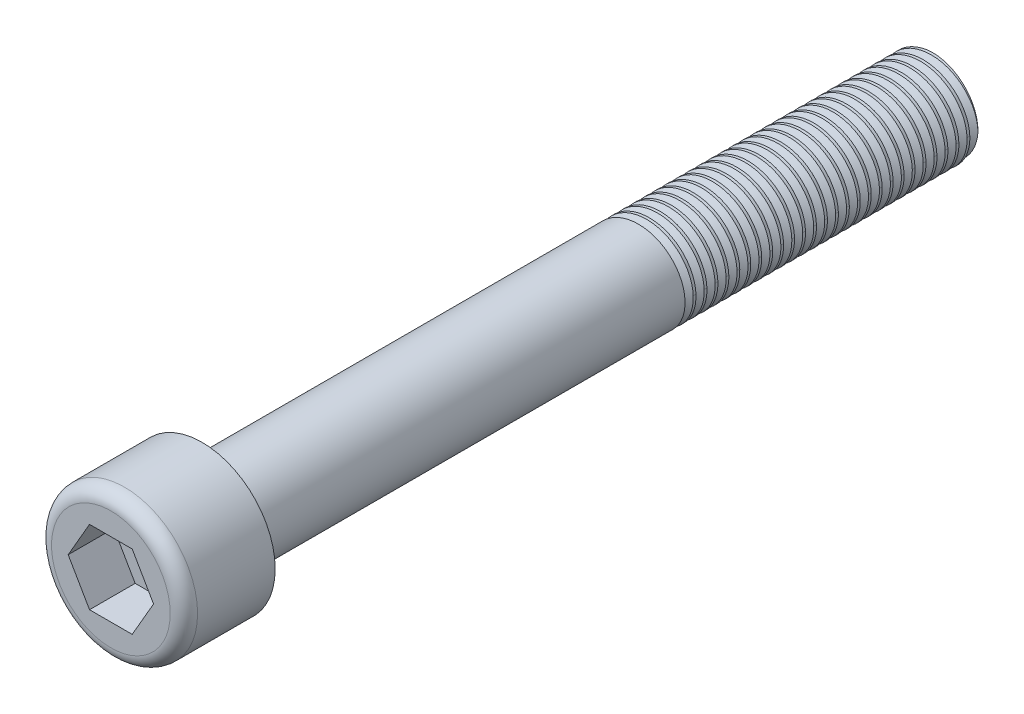
from build123d import *

# Parameters (mm, degrees)
SKETCH1_R           = 8
BOSS_EXTRUDE1_DEPTH = 10
FILLET1_R           = 1.5
CUT_EXTRUDE1_DEPTH  = 5
SKETCH4_R           = 5
BOSS_EXTRUDE2_DEPTH = 80
CUT_SWEEP1_PITCH    = 1.2
CUT_EXTRUDE2_DEPTH  = 80


with BuildPart() as part:
    # Sketch1 → Boss-Extrude1 (new body)
    with BuildSketch(Plane.XY):
        Circle(SKETCH1_R)
    extrude(amount=BOSS_EXTRUDE1_DEPTH)

    # Fillet1
    fillet1_edges = [part.edges().sort_by_distance(p)[0] for p in [
        (-8, 0, 10),
    ]]
    fillet(fillet1_edges, radius=FILLET1_R)

    # Sketch2 → Cut-Extrude1 (cut)
    with BuildSketch(Plane.XY.offset(10)):
        Polygon((4.67653718, 0), (2.33826859, 4.05), (-2.33826859, 4.05), (-4.67653718, 0), (-2.33826859, -4.05), (2.33826859, -4.05), align=None)
    extrude(amount=-CUT_EXTRUDE1_DEPTH, mode=Mode.SUBTRACT)

    # Sketch4 → Boss-Extrude2 (add)
    with BuildSketch(Plane(origin=(0, 0, 0), x_dir=(-1, 0, 0), z_dir=(0, 0, -1))):
        Circle(SKETCH4_R)
    extrude(amount=BOSS_EXTRUDE2_DEPTH)

    # Cut-Sweep1: the profile of Sketch6 profile screwed along a right-hand helix of 27.5 turns, 8 arcs to a turn; built about Z, then put on its axis
    cut_sweep1_z = Axis((0, 0, 0), (0, 0, 1))
    cut_sweep1_corners = [(5.0003, 0, 0.000210062), (5.0003, 0, -0.900210062), (4.357333397, 0, -0.45)]
    with BuildLine(mode=Mode.PRIVATE) as cut_sweep1_profile:
        Line(cut_sweep1_corners[0], cut_sweep1_corners[1])
        Line(cut_sweep1_corners[1], cut_sweep1_corners[2])
        Line(cut_sweep1_corners[2], cut_sweep1_corners[0])
    cut_sweep1_cap = Face(cut_sweep1_profile.wire())
    cut_sweep1_turn_angles = [0, 22.5, 45, 67.5, 90, 112.5, 135, 157.5, 180, 202.5, 225, 247.5, 270, 292.5, 315, 337.5, 360]
    cut_sweep1_turn_weights = [1, 0.9238795325112867, 1, 0.9238795325112867, 1, 0.9238795325112867, 1, 0.9238795325112867, 1, 0.9238795325112867, 1, 0.9238795325112867, 1, 0.9238795325112867, 1, 0.9238795325112867, 1]
    cut_sweep1_turn_rails = [Edge.make_bspline([Vector(p[0], p[1], 0).rotate(cut_sweep1_z, cut_sweep1_turn_angles[k]) / cut_sweep1_turn_weights[k] + Vector(0, 0, p[2] + CUT_SWEEP1_PITCH * cut_sweep1_turn_angles[k] / 360) for k in range(17)], [0, 0, 0, 1, 1, 2, 2, 3, 3, 4, 4, 5, 5, 6, 6, 7, 7, 8, 8, 8], 2, cut_sweep1_turn_weights) for p in cut_sweep1_corners]
    cut_sweep1_turn_sides = [Face.make_surface_from_curves(cut_sweep1_turn_rails[p[0]], cut_sweep1_turn_rails[p[1]]) for p in [(0, 1), (1, 2), (2, 0)]]
    cut_sweep1_last_angles = [9720, 9742.5, 9765, 9787.5, 9810, 9832.5, 9855, 9877.5, 9900]
    cut_sweep1_last_weights = [1, 0.9238795325112867, 1, 0.9238795325112867, 1, 0.9238795325112867, 1, 0.9238795325113475, 1]
    cut_sweep1_last_rails = [Edge.make_bspline([Vector(p[0], p[1], 0).rotate(cut_sweep1_z, cut_sweep1_last_angles[k]) / cut_sweep1_last_weights[k] + Vector(0, 0, p[2] + CUT_SWEEP1_PITCH * cut_sweep1_last_angles[k] / 360) for k in range(9)], [0, 0, 0, 1, 1, 2, 2, 3, 3, 4, 4, 4], 2, cut_sweep1_last_weights) for p in cut_sweep1_corners]
    cut_sweep1_last_sides = [Face.make_surface_from_curves(cut_sweep1_last_rails[p[0]], cut_sweep1_last_rails[p[1]]) for p in [(0, 1), (1, 2), (2, 0)]]
    cut_sweep1 = Plane(origin=(0, 0, -80), x_dir=(0, 1, 0), z_dir=(0, 0, 1)) * Solid(Shell([*[p.moved(Location((0, 0, CUT_SWEEP1_PITCH * i))) for i in range(27) for p in cut_sweep1_turn_sides], *cut_sweep1_last_sides, cut_sweep1_cap, cut_sweep1_cap.rotate(cut_sweep1_z, 9900).moved(Location((0, 0, CUT_SWEEP1_PITCH * 9900 / 360)))]))
    add(cut_sweep1, mode=Mode.SUBTRACT)

    # Sketch7 → Cut-Extrude2 (cut)
    with BuildSketch(Plane.ZY):
        Polygon((-47.45, -4.357333397), (-47.9, -5), (-47, -5), align=None)
    extrude(amount=-CUT_EXTRUDE2_DEPTH, mode=Mode.SUBTRACT)


solid = part.part
